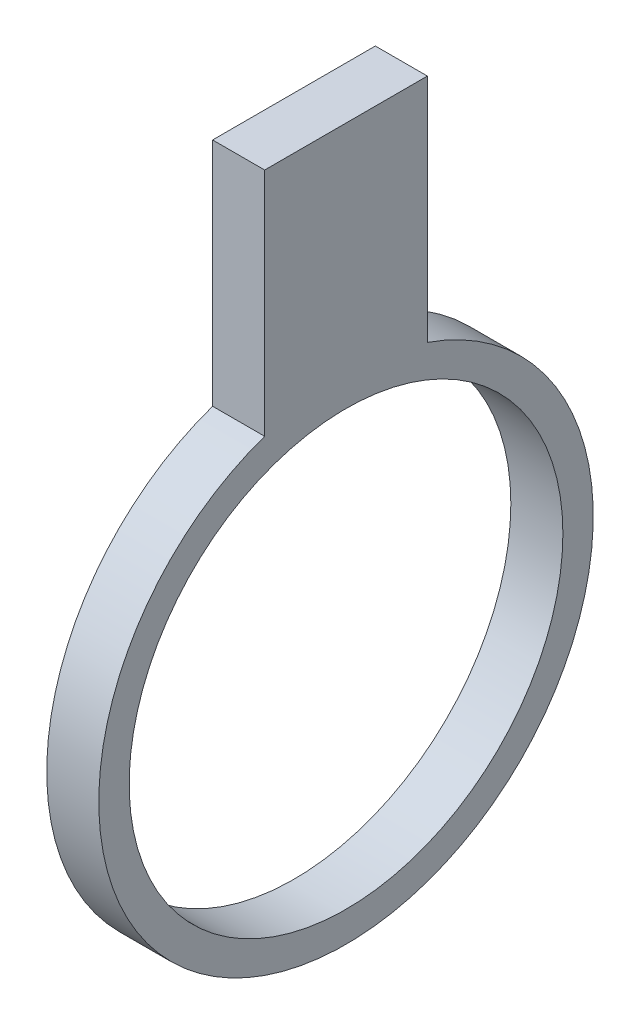
from build123d import *

# Parameters (mm, degrees)
SKETCH1_R           = 28.5
BOSS_EXTRUDE1_DEPTH = 3
SKETCH2_R           = 25
CUT_EXTRUDE1_DEPTH  = 41.749233122
BOSS_EXTRUDE2_DEPTH = 3


with BuildPart() as part:
    # Sketch1 → Boss-Extrude1 (new, symmetric)
    with BuildSketch(Plane(origin=(0, 0, 0), x_dir=(0, 0, -1), z_dir=(1, 0, 0))):
        Circle(SKETCH1_R)
    extrude(amount=BOSS_EXTRUDE1_DEPTH, both=True)

    # Sketch2 → Cut-Extrude1 (cut, through all)
    with BuildSketch(Plane(origin=(3, 0, 0), x_dir=(0, 0, -1), z_dir=(1, 0, 0))):
        Circle(SKETCH2_R)
    extrude(amount=-CUT_EXTRUDE1_DEPTH, mode=Mode.SUBTRACT)

    # Sketch3 → Boss-Extrude2 (add, symmetric)
    with BuildSketch(Plane(origin=(0, 0, 0), x_dir=(0, 0, -1), z_dir=(1, 0, 0))):
        with BuildLine():
            Line((-9.379163336, 53.5), (-9.379163336, 26.912474712))
            ThreePointArc((-9.379163336, 26.912474712), (0, 28.5), (9.379163336, 26.912474712))
            Line((9.379163336, 26.912474712), (9.379163336, 53.5))
            Line((9.379163336, 53.5), (-9.379163336, 53.5))
        make_face()
    extrude(amount=BOSS_EXTRUDE2_DEPTH, both=True)


solid = part.part
